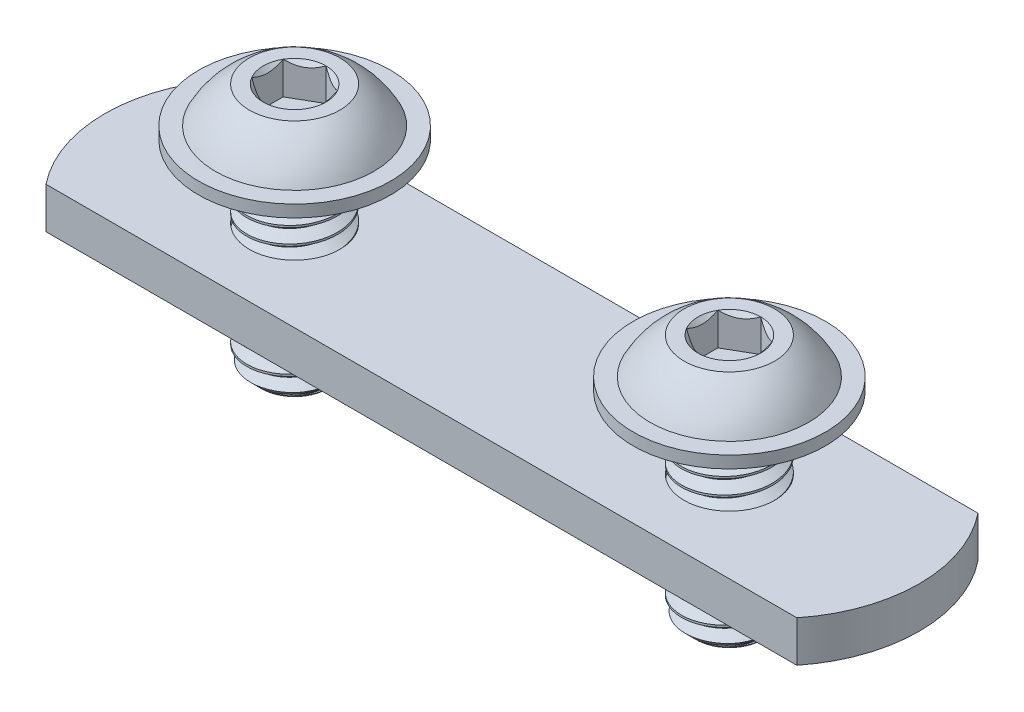
from build123d import *

# Parameters (mm, degrees)
SKETCH1_R           = 3.96875
BOSS_EXTRUDE1_DEPTH = 17.4625
CUT_SWEEP1_PITCH    = 1.411111111
SKETCH4_OUTSIDE_W   = 16.912
SKETCH4_OUTSIDE_H   = 16.912
SKETCH4_OUTSIDE_R   = 2.899449189
CUT_EXTRUDE1_DEPTH  = 1.411111111
CUT_EXTRUDE1_DRAFT  = -45
CUT_EXTRUDE2_DEPTH  = 2.8575
BOSS_EXTRUDE2_START = -6.35
SKETCH8_R           = 3.96875
BOSS_EXTRUDE2_DEPTH = 3.6068
SKETCH9_R           = 4.5593
SKETCH9_R_2         = 3.96875
BOSS_EXTRUDE3_DEPTH = 2.032


with BuildPart() as part:
    # Sketch1 → Boss-Extrude1 (new body)
    with BuildSketch(Plane(origin=(0, 0, 0), x_dir=(1, 0, 0), z_dir=(0, 1, 0))):
        with Locations(Location((-19.05, 0, 0), (0, 0, 270))):
            Circle(SKETCH1_R)
    extrude(amount=-BOSS_EXTRUDE1_DEPTH)

    # Cut-Sweep1: the profile of Sketch3 screwed along a right-hand helix of 13.375 turns, 8 arcs to a turn; built about Z, then put on its axis
    cut_sweep1_z = Axis((0, 0, 0), (0, 0, 1))
    cut_sweep1_corners = [(3.052206448, 0, -0.529166667), (4.045128629, 0, 0.044097222), (4.045128629, 0, -1.278819444), (3.052206448, 0, -0.705555556)]
    with BuildLine(mode=Mode.PRIVATE) as cut_sweep1_profile:
        Line(cut_sweep1_corners[0], cut_sweep1_corners[1])
        Line(cut_sweep1_corners[1], cut_sweep1_corners[2])
        Line(cut_sweep1_corners[2], cut_sweep1_corners[3])
        Line(cut_sweep1_corners[3], cut_sweep1_corners[0])
    cut_sweep1_cap = Face(cut_sweep1_profile.wire())
    cut_sweep1_turn_angles = [0, 22.5, 45, 67.5, 90, 112.5, 135, 157.5, 180, 202.5, 225, 247.5, 270, 292.5, 315, 337.5, 360]
    cut_sweep1_turn_weights = [1, 0.9238795325112867, 1, 0.9238795325112867, 1, 0.9238795325112867, 1, 0.9238795325112867, 1, 0.9238795325112867, 1, 0.9238795325112867, 1, 0.9238795325112867, 1, 0.9238795325112867, 1]
    cut_sweep1_turn_rails = [Edge.make_bspline([Vector(p[0], p[1], 0).rotate(cut_sweep1_z, cut_sweep1_turn_angles[k]) / cut_sweep1_turn_weights[k] + Vector(0, 0, p[2] + CUT_SWEEP1_PITCH * cut_sweep1_turn_angles[k] / 360) for k in range(17)], [0, 0, 0, 1, 1, 2, 2, 3, 3, 4, 4, 5, 5, 6, 6, 7, 7, 8, 8, 8], 2, cut_sweep1_turn_weights) for p in cut_sweep1_corners]
    cut_sweep1_turn_sides = [Face.make_surface_from_curves(cut_sweep1_turn_rails[p[0]], cut_sweep1_turn_rails[p[1]]) for p in [(0, 1), (1, 2), (2, 3), (3, 0)]]
    cut_sweep1_last_angles = [4680, 4702.5, 4725, 4747.5, 4770, 4792.5, 4815]
    cut_sweep1_last_weights = [1, 0.9238795325112867, 1, 0.9238795325112867, 1, 0.9238795325112594, 1]
    cut_sweep1_last_rails = [Edge.make_bspline([Vector(p[0], p[1], 0).rotate(cut_sweep1_z, cut_sweep1_last_angles[k]) / cut_sweep1_last_weights[k] + Vector(0, 0, p[2] + CUT_SWEEP1_PITCH * cut_sweep1_last_angles[k] / 360) for k in range(7)], [0, 0, 0, 1, 1, 2, 2, 3, 3, 3], 2, cut_sweep1_last_weights) for p in cut_sweep1_corners]
    cut_sweep1_last_sides = [Face.make_surface_from_curves(cut_sweep1_last_rails[p[0]], cut_sweep1_last_rails[p[1]]) for p in [(0, 1), (1, 2), (2, 3), (3, 0)]]
    cut_sweep1 = Plane(origin=(-19.05, -17.4625, 0), x_dir=(0, 0, -1), z_dir=(0, 1, 0)) * Solid(Shell([*[p.moved(Location((0, 0, CUT_SWEEP1_PITCH * i))) for i in range(13) for p in cut_sweep1_turn_sides], *cut_sweep1_last_sides, cut_sweep1_cap, cut_sweep1_cap.rotate(cut_sweep1_z, 4815).moved(Location((0, 0, CUT_SWEEP1_PITCH * 4815 / 360)))]))
    add(cut_sweep1, mode=Mode.SUBTRACT)


with BuildPart() as cut_extrude1_tool:
    # Sketch4 outside → Cut-Extrude1 (with draft: the straight prism first)
    with BuildSketch(Plane.XZ.offset(17.4625)):
        with Locations((-19.05, 0)):
            Rectangle(SKETCH4_OUTSIDE_W, SKETCH4_OUTSIDE_H)
        with Locations((-19.05, 0)):
            Circle(SKETCH4_OUTSIDE_R, mode=Mode.SUBTRACT)
    extrude(amount=-CUT_EXTRUDE1_DEPTH)
    # Cut-Extrude1: the draft: its side faces are tilted about the plane it starts from
    cut_extrude1_sides = [cut_extrude1_tool.faces().sort_by_distance(p)[0] for p in [
        (-19.05, -16.756944444, -8.456),
        (-10.594, -16.756944444, 0),
        (-19.05, -16.756944444, 8.456),
        (-27.506, -16.756944444, 0),
        (-21.949449189, -16.756944444, 0),
    ]]
    draft(cut_extrude1_sides, Plane.XZ.offset(17.4625), CUT_EXTRUDE1_DRAFT)


with BuildPart() as part_1:
    add(part.part)

    # Cut-Extrude1: cut by cut_extrude1_tool
    add(cut_extrude1_tool.part, mode=Mode.SUBTRACT)

    # Sketch5 → Revolve1 (revolve)
    with BuildSketch(Plane.XY, mode=Mode.PRIVATE) as revolve1_sk:
        with BuildLine():
            Line((-19.05, 0), (-19.05, 4.2164))
            Line((-19.05, 4.2164), (-23.01875, 4.2164))
            ThreePointArc((-23.01875, 4.2164), (-24.732243312, 2.846599775), (-25.9969, 1.0541))
            Line((-25.9969, 1.0541), (-27.4701, 1.0541))
            Line((-27.4701, 1.0541), (-27.4701, 0))
            Line((-27.4701, 0), (-19.05, 0))
        make_face()
    revolve(revolve1_sk.sketch.rotate(Axis((-19.05, 0, 0), (0, 1, 0)), 270), axis=Axis((-19.05, 0, 0), (0, 1, 0)))

    # Sketch6 → Cut-Extrude2 (cut)
    with BuildSketch(Plane(origin=(0, 4.2164, 0), x_dir=(1, 0, 0), z_dir=(0, 1, 0))):
        Polygon((-19.05, 2.749630657), (-21.43125, 1.374815329), (-21.43125, -1.374815329), (-19.05, -2.749630657), (-16.66875, -1.374815329), (-16.66875, 1.374815329), align=None)
    extrude(amount=-CUT_EXTRUDE2_DEPTH, mode=Mode.SUBTRACT)

    # Cut-Extrude3 cone 1 section (through the dimple's axis) → Cut-Extrude3 (revolve, cut)
    with BuildSketch(Plane(origin=(-19.05, 4.2164, 0), x_dir=(0, 0, 1), z_dir=(1, 0, 0))):
        Polygon((0, 0), (2.749630657, 0), (0, 2.749630657), align=None)
    revolve(axis=Axis((-19.05, 4.2164, 0), (0, -1, 0)), mode=Mode.SUBTRACT)


with BuildPart() as body_2:
    # Body-Move/Copy1: copy of part
    add(part_1.part.moved(Location((38.1, 0, 0))))


with BuildPart() as body_3:
    # Sketch8 → Boss-Extrude2 (new body)
    with BuildSketch(Plane(origin=(0, 0, 0), x_dir=(1, 0, 0), z_dir=(0, 1, 0)).offset(BOSS_EXTRUDE2_START)):
        with BuildLine():
            Line((-32.900934322, 7.9375), (32.900934322, 7.9375))
            ThreePointArc((32.900934322, 7.9375), (35.687, 0), (32.900934322, -7.9375))
            Line((32.900934322, -7.9375), (-32.900934322, -7.9375))
            ThreePointArc((-32.900934322, -7.9375), (-35.687, 0), (-32.900934322, 7.9375))
        make_face()
        with Locations(Location((19.05, 0, 0), (0, 0, 270))):
            Circle(SKETCH8_R, mode=Mode.SUBTRACT)
        with Locations(Location((-19.05, 0, 0), (0, 0, 270))):
            Circle(SKETCH8_R, mode=Mode.SUBTRACT)
    extrude(amount=-BOSS_EXTRUDE2_DEPTH)

    # Sketch9 → Boss-Extrude3 (add)
    # profile 1 of 2: a face of its own
    with BuildSketch(Plane.XZ.offset(9.9568)):
        with Locations(Location((-19.05, 0, 0), (0, 0, 90))):
            Circle(SKETCH9_R)
        with Locations(Location((-19.05, 0, 0), (0, 0, 90))):
            Circle(SKETCH9_R_2, mode=Mode.SUBTRACT)
    # profile 2 of 2: a face of its own
    with BuildSketch(Plane.XZ.offset(9.9568)):
        with Locations(Location((19.05, 0, 0), (0, 0, 90))):
            Circle(SKETCH9_R)
        with Locations(Location((19.05, 0, 0), (0, 0, 90))):
            Circle(SKETCH9_R_2, mode=Mode.SUBTRACT)
    extrude(amount=BOSS_EXTRUDE3_DEPTH)


solid = Compound([part_1.part, body_2.part, body_3.part])
